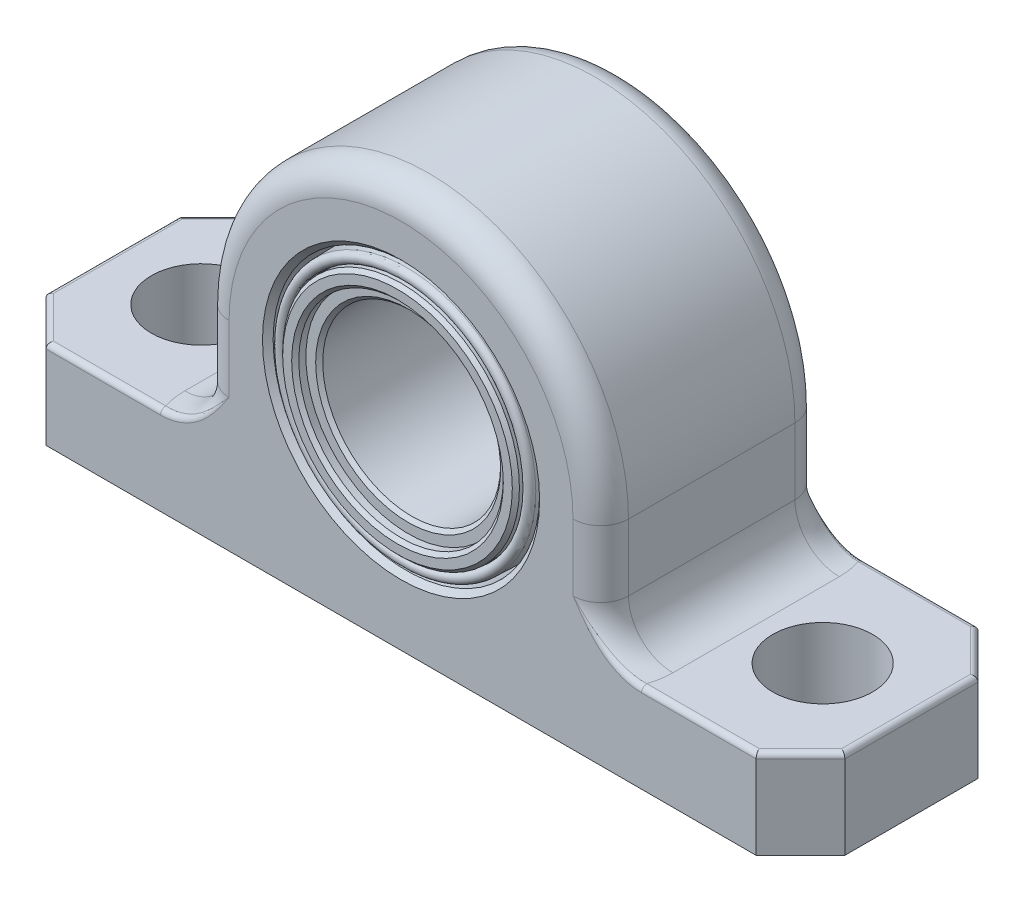
from build123d import *

# Parameters (mm, degrees)
BOSS_EXTRUDE1_DEPTH      = 7.9375
BOSS_EXTRUDE1_DEPTH_BACK = 7.9375
SKETCH3_R                = 9.53262
SKETCH4_R                = 3.571875
CUT_EXTRUDE1_DEPTH       = 42.183311623
CHAMFER1_SIZE            = 3.175
FILLET1_R                = 1.984375
FILLET2_R                = 3.175
CHAMFER2_SIZE            = 0.381
FILLET3_R                = 0.381
CHAMFER3_SIZE            = 0.254


with BuildPart() as part:
    # Sketch3 → Boss-Extrude1 (new, two sides: drawn at the far end of the back side and taken through both)
    with BuildSketch(Plane.XY.offset(-BOSS_EXTRUDE1_DEPTH_BACK)):
        with BuildLine():
            Line((-28.575, 0), (-28.575, 6.35))
            Line((-28.575, 6.35), (-14.2875, 6.35))
            Line((-14.2875, 6.35), (-14.2875, 14.2875))
            ThreePointArc((-14.2875, 14.2875), (0, 28.575), (14.2875, 14.2875))
            Line((14.2875, 14.2875), (14.2875, 6.35))
            Line((14.2875, 6.35), (28.575, 6.35))
            Line((28.575, 6.35), (28.575, 0))
            Line((28.575, 0), (-28.575, 0))
        make_face()
        with Locations((0, 14.2875)):
            Circle(SKETCH3_R, mode=Mode.SUBTRACT)
    extrude(amount=BOSS_EXTRUDE1_DEPTH + BOSS_EXTRUDE1_DEPTH_BACK)

    # Sketch4 → Cut-Extrude1 (cut, through all)
    with BuildSketch(Plane(origin=(0, 0, 0), x_dir=(1, 0, 0), z_dir=(0, 1, 0))):
        with Locations(Location((-22.225, 0, 0), (0, 0, 270))):
            Circle(SKETCH4_R)
        with Locations(Location((22.225, 0, 0), (0, 0, 180))):
            Circle(SKETCH4_R)
    extrude(amount=CUT_EXTRUDE1_DEPTH, mode=Mode.SUBTRACT)

    # Chamfer1
    chamfer1_edges = [part.edges().sort_by_distance(p)[0] for p in [
        (28.575, 3.175, 7.9375),
        (-28.575, 3.175, -7.9375),
        (-28.575, 3.175, 7.9375),
        (28.575, 3.175, -7.9375),
    ]]
    chamfer(chamfer1_edges, length=CHAMFER1_SIZE)

    # Fillet1
    fillet1_edges = [part.edges().sort_by_distance(p)[0] for p in [
        (14.2875, 10.31875, -7.9375),
        (0, 28.575, -7.9375),
        (-14.2875, 10.31875, -7.9375),
        (14.2875, 10.31875, 7.9375),
        (0, 28.575, 7.9375),
        (-14.2875, 10.31875, 7.9375),
    ]]
    fillet(fillet1_edges, radius=FILLET1_R)

    # Fillet2
    # the kernel refuses this fillet: 3.175 mm, written as the material it adds along each edge
    with BuildSketch(Plane(origin=(-14.2875, 6.35, 5.953125), x_dir=(-1, 0, 0), z_dir=(0, 0, -1))) as fillet2_piece_1:
        with BuildLine():
            CenterArc((FILLET2_R, FILLET2_R), FILLET2_R, 180, 90)
            Line((0, FILLET2_R), (0, 0))
            Line((0, 0), (FILLET2_R, 0))
        make_face()
    extrude(amount=11.90625)
    with BuildSketch(Plane(origin=(14.2875, 6.35, 5.953125), x_dir=(1, 0, 0), z_dir=(0, 0, -1))) as fillet2_piece_2:
        with BuildLine():
            CenterArc((FILLET2_R, -FILLET2_R), FILLET2_R, 90, 90)
            Line((0, -FILLET2_R), (0, 0))
            Line((0, 0), (FILLET2_R, 0))
        make_face()
    extrude(amount=11.90625)
    with BuildSketch(Plane(origin=(-12.303125, 6.35, -5.953125), x_dir=(-0.7578518137495754, 0, 0.6524267226259811), z_dir=(-0.6524267226259811, 0, -0.7578518137495754))) as fillet2_piece_3_section:
        with BuildLine():
            CenterArc((-1.984375 - FILLET2_R, FILLET2_R), FILLET2_R, 270, 90)
            Line((-1.984375, FILLET2_R), (-1.984375, 0))
            Line((-1.984375, 0), (-1.984375 - FILLET2_R, 0))
        make_face()
    fillet2_piece_3 = revolve(axis=Axis((-12.303125, 6.35, -5.953125), (0, 1, 0)), revolution_arc=319.27518278, mode=Mode.PRIVATE)
    fillet2_piece_3 = split(fillet2_piece_3, bisect_by=Plane(origin=(-13.806400023, 7.435141172, -7.9375), z_dir=(0, 0, 1)), keep=Keep.TOP, mode=Mode.PRIVATE)
    add(fillet2_piece_3)
    with BuildSketch(Plane(origin=(-12.303125, 6.35, 5.953125), x_dir=(-0.7578518137495754, 0, -0.6524267226259811), z_dir=(-0.6524267226259811, 0, 0.7578518137495754))) as fillet2_piece_4_section:
        with BuildLine():
            CenterArc((-1.984375 - FILLET2_R, -FILLET2_R), FILLET2_R, 0, 90)
            Line((-1.984375, -FILLET2_R), (-1.984375, 0))
            Line((-1.984375, 0), (-1.984375 - FILLET2_R, 0))
        make_face()
    fillet2_piece_4 = revolve(axis=Axis((-12.303125, 6.35, 5.953125), (0, -1, 0)), revolution_arc=319.27518278, mode=Mode.PRIVATE)
    fillet2_piece_4 = split(fillet2_piece_4, bisect_by=Plane(origin=(-13.806400023, 7.435141172, 7.9375), z_dir=(0, 0, -1)), keep=Keep.TOP, mode=Mode.PRIVATE)
    add(fillet2_piece_4)
    with BuildSketch(Plane(origin=(12.303125, 6.35, -5.953125), x_dir=(0.7578518137495768, 0, 0.6524267226259794), z_dir=(0.6524267226259794, 0, -0.7578518137495768))) as fillet2_piece_5_section:
        with BuildLine():
            CenterArc((-1.984375 - FILLET2_R, -FILLET2_R), FILLET2_R, 360, 90)
            Line((-1.984375, -FILLET2_R), (-1.984375, 0))
            Line((-1.984375, 0), (-1.984375 - FILLET2_R, 0))
        make_face()
    fillet2_piece_5 = revolve(axis=Axis((12.303125, 6.35, -5.953125), (0, -1, 0)), revolution_arc=319.27518278, mode=Mode.PRIVATE)
    fillet2_piece_5 = split(fillet2_piece_5, bisect_by=Plane(origin=(13.8064, 7.435141487, -7.9375), z_dir=(0, 0, 1)), keep=Keep.TOP, mode=Mode.PRIVATE)
    add(fillet2_piece_5)
    with BuildSketch(Plane(origin=(12.303125, 6.35, 5.953125), x_dir=(0.7578518137495768, 0, -0.6524267226259794), z_dir=(0.6524267226259794, 0, 0.7578518137495768))) as fillet2_piece_6_section:
        with BuildLine():
            CenterArc((-1.984375 - FILLET2_R, FILLET2_R), FILLET2_R, 270, 90)
            Line((-1.984375, FILLET2_R), (-1.984375, 0))
            Line((-1.984375, 0), (-1.984375 - FILLET2_R, 0))
        make_face()
    fillet2_piece_6 = revolve(axis=Axis((12.303125, 6.35, 5.953125), (0, 1, 0)), revolution_arc=319.27518278, mode=Mode.PRIVATE)
    fillet2_piece_6 = split(fillet2_piece_6, bisect_by=Plane(origin=(13.8064, 7.435141487, 7.9375), z_dir=(0, 0, -1)), keep=Keep.TOP, mode=Mode.PRIVATE)
    add(fillet2_piece_6)

    # Chamfer2
    chamfer2_edges = [part.edges().sort_by_distance(p)[0] for p in [
        (-9.53262, 14.2875, -7.9375),
        (-9.53262, 14.2875, 7.9375),
    ]]
    chamfer(chamfer2_edges, length=CHAMFER2_SIZE)

    # Fillet3
    fillet3_edges = [part.edges().sort_by_distance(p)[0] for p in [
        (-21.2328125, 6.35, -7.9375),
        (-21.2328125, 6.35, 7.9375),
        (-14.328484078, 7.361660922, -7.9375),
        (-14.328484078, 7.361660922, 7.9375),
        (14.328484078, 7.361660922, -7.9375),
        (14.328484078, 7.361660922, 7.9375),
        (-28.575, 6.35, 0),
        (21.2328125, 6.35, -7.9375),
        (-26.9875, 6.35, 6.35),
        (-26.9875, 6.35, -6.35),
        (21.2328125, 6.35, 7.9375),
        (28.575, 6.35, 0),
        (26.9875, 6.35, -6.35),
        (26.9875, 6.35, 6.35),
    ]]
    fillet(fillet3_edges, radius=FILLET3_R)


with BuildPart() as body_2:
    # Sketch6 → Revolve1 (revolve)
    with BuildSketch(Plane(origin=(0, 0, 0), x_dir=(0, 0, -1), z_dir=(1, 0, 0)), mode=Mode.PRIVATE) as revolve1_sk:
        with BuildLine():
            Line((0, 23.82012), (7.9375, 23.82012))
            Line((7.9375, 23.82012), (7.9375, 22.806653146))
            Line((7.9375, 22.806653146), (5.3975, 22.806653146))
            Line((5.3975, 22.806653146), (5.3975, 22.757303182))
            Line((5.3975, 22.757303182), (7.9375, 22.757303182))
            Line((7.9375, 22.757303182), (7.9375, 21.604605))
            Line((7.9375, 21.604605), (7.1755, 21.604605))
            Line((7.1755, 21.604605), (7.1755, 20.6502))
            Line((7.1755, 20.6502), (-7.4295, 20.6502))
            Line((-7.4295, 20.6502), (-7.4295, 21.604605))
            Line((-7.4295, 21.604605), (-8.1915, 21.604605))
            Line((-8.1915, 21.604605), (-8.1915, 22.757303182))
            Line((-8.1915, 22.757303182), (-7.4295, 22.757303182))
            Line((-7.4295, 22.757303182), (-7.4295, 22.806653146))
            ThreePointArc((-7.4295, 22.806653146), (-7.931261591, 23.102267559), (-7.566071414, 23.555906964))
            Line((-7.566071414, 23.555906964), (0, 23.82012))
        make_face()
    revolve(revolve1_sk.sketch.rotate(Axis((0, 14.2875, 7.9375), (0, 0, -1)), 90), axis=Axis((0, 14.2875, 7.9375), (0, 0, -1)))

    # Chamfer3
    chamfer3_edges = [body_2.edges().sort_by_distance(p)[0] for p in [
        (-8.469803182, 14.2875, -7.9375),
        (-7.317105, 14.2875, -7.9375),
        (-6.3627, 14.2875, -7.1755),
        (-6.3627, 14.2875, 7.4295),
        (-7.317105, 14.2875, 8.1915),
        (-8.469803182, 14.2875, 8.1915),
    ]]
    chamfer(chamfer3_edges, length=CHAMFER3_SIZE)


solid = Compound([part.part, body_2.part])
